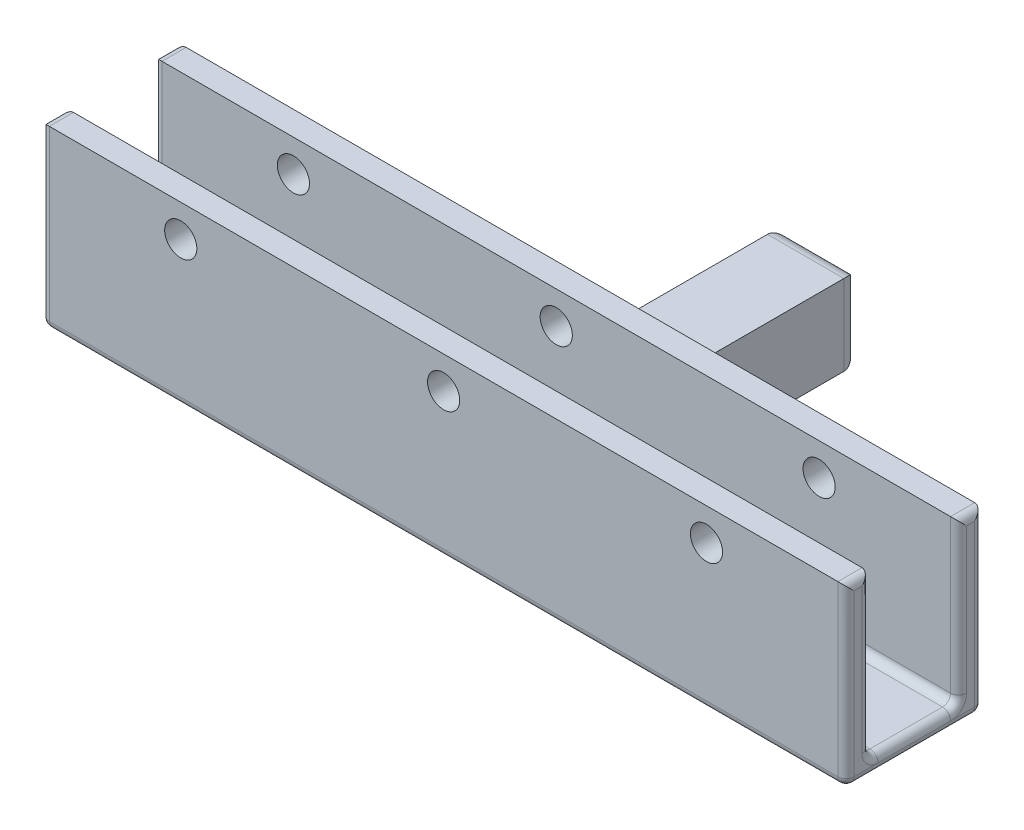
from build123d import *

# Parameters (mm, degrees)
SKETCH2_W                = 100
SKETCH2_H                = 3
SKETCH2_H_2              = 11
BOSS_EXTRUDE2_DEPTH      = 2
SKETCH3_W                = 100
SKETCH3_H                = 3
BOSS_EXTRUDE3_DEPTH      = 20
FILLET2_R                = 1
BOSS_EXTRUDE5_DEPTH      = 30
BOSS_EXTRUDE5_DEPTH_BACK = 1
SKETCH5_W                = 9.5
SKETCH5_H                = 10
FILLET3_R                = 2
FILLET4_R                = 2
SKETCH6_R                = 2
CUT_EXTRUDE1_DEPTH       = 39
SKETCH7_R                = 2
CUT_EXTRUDE2_DEPTH       = 39


# Some blends are built 0.0001 mm under size
with BuildPart() as part:
    # Sketch2 → Boss-Extrude2 (new body)
    with BuildSketch(Plane(origin=(0, 0, 0), x_dir=(1, 0, 0), z_dir=(0, 1, 0))):
        with Locations((-50, 1.5)):
            Rectangle(SKETCH2_W, SKETCH2_H)
        with Locations((-50, -5.5)):
            Rectangle(SKETCH2_W, SKETCH2_H_2)
        with Locations((-50, -12.5)):
            Rectangle(SKETCH2_W, SKETCH2_H)
    extrude(amount=BOSS_EXTRUDE2_DEPTH)

    # Sketch3 → Boss-Extrude3 (add)
    with BuildSketch(Plane(origin=(0, 2, 0), x_dir=(1, 0, 0), z_dir=(0, 1, 0))):
        with Locations((-50, -12.5)):
            Rectangle(SKETCH3_W, SKETCH3_H)
        with Locations((-50, 1.5)):
            Rectangle(SKETCH3_W, SKETCH3_H)
    extrude(amount=BOSS_EXTRUDE3_DEPTH)

    # Fillet2
    fillet2_edges = [part.edges().sort_by_distance(p)[0] for p in [
        (-100, 11, -3),
        (0, 11, -3),
        (0, 11, 14),
        (-100, 11, 14),
        (-100, 2, 5.5),
        (0, 2, 5.5),
        (0, 12, 11),
        (-100, 12, 11),
        (-100, 22, 12.5),
        (0, 22, 12.5),
        (-50, 2, 11),
        (-50, 2, 0),
        (-100, 12, 0),
        (0, 12, 0),
        (-100, 22, -1.5),
        (0, 22, -1.5),
        (-50, 0, -3),
        (0, 0, 5.5),
        (-50, 0, 14),
        (-100, 0, 5.5),
    ]]
    fillet(fillet2_edges, radius=FILLET2_R - 0.0001)  # a hair under: the kernel refuses the full size

    # Sketch5 → Boss-Extrude5 (add, two sides: drawn at the far end of the back side and taken through both)
    with BuildSketch(Plane(origin=(0, 0, -3), x_dir=(-1, 0, 0), z_dir=(0, 0, -1)).offset(-BOSS_EXTRUDE5_DEPTH_BACK)):
        with Locations((50, 5)):
            Rectangle(SKETCH5_W, SKETCH5_H)
    extrude(amount=BOSS_EXTRUDE5_DEPTH + BOSS_EXTRUDE5_DEPTH_BACK)

    # Fillet3
    fillet3_edges = [part.edges().sort_by_distance(p)[0] for p in [
        (-45.25, 5, -33),
        (-50, 0, -33),
        (-54.75, 5, -33),
        (-50, 10, -33),
    ]]
    fillet(fillet3_edges, radius=FILLET3_R)

    # Fillet4
    # the kernel refuses this fillet: 2 mm, written as the material it adds along each edge
    with BuildSketch(Plane(origin=(-54.75, 0.9999, -2.0001), x_dir=(0, 0.0062831439655585564, -0.9999802608561371), z_dir=(0, -0.9999802608561371, -0.0062831439655585564))) as fillet4_piece_1_section:
        with BuildLine():
            CenterArc((-0.9999 - FILLET4_R, -FILLET4_R), FILLET4_R, 0, 90)
            Line((-0.9999, -FILLET4_R), (-0.9999, 0))
            Line((-0.9999, 0), (-0.9999 - FILLET4_R, 0))
        make_face()
    fillet4_piece_1 = revolve(axis=Axis((-54.75, 0.9999, -2.0001), (1, 0, 0)), revolution_arc=359.64, mode=Mode.PRIVATE)
    fillet4_piece_1 = split(fillet4_piece_1, bisect_by=Plane(origin=(-55.461006322, 0, -2.760267515), z_dir=(0, 1, 0)), keep=Keep.TOP, mode=Mode.PRIVATE)
    fillet4_piece_1 = split(fillet4_piece_1, bisect_by=Plane(origin=(-55.461006322, 0.239732481, 0), z_dir=(0, 0, -1)), keep=Keep.TOP, mode=Mode.PRIVATE)
    add(fillet4_piece_1)
    with BuildSketch(Plane(origin=(-45.25, 0.9999, -2.0001), x_dir=(0, 0.0062831439655585564, -0.9999802608561371), z_dir=(0, -0.9999802608561371, -0.0062831439655585564))) as fillet4_piece_2_section:
        with BuildLine():
            CenterArc((-0.9999 - FILLET4_R, FILLET4_R), FILLET4_R, 270, 90)
            Line((-0.9999, FILLET4_R), (-0.9999, 0))
            Line((-0.9999, 0), (-0.9999 - FILLET4_R, 0))
        make_face()
    fillet4_piece_2 = revolve(axis=Axis((-45.25, 0.9999, -2.0001), (1, 0, 0)), revolution_arc=359.64, mode=Mode.PRIVATE)
    fillet4_piece_2 = split(fillet4_piece_2, bisect_by=Plane(origin=(-44.538993678, 0, -2.760267519), z_dir=(0, 1, 0)), keep=Keep.TOP, mode=Mode.PRIVATE)
    fillet4_piece_2 = split(fillet4_piece_2, bisect_by=Plane(origin=(-44.538993678, 0.239732485, 0), z_dir=(0, 0, -1)), keep=Keep.TOP, mode=Mode.PRIVATE)
    add(fillet4_piece_2)
    with BuildSketch(Plane(origin=(-45.25, 10, -3), x_dir=(0, 0, -1), z_dir=(0, -1, 0)), Plane(origin=(-54.75, 0.9999, -3), x_dir=(0, 0, -1), z_dir=(0, 1, 0))) as fillet4_piece_3:
        with BuildLine():
            CenterArc((FILLET4_R, FILLET4_R), FILLET4_R, 180, 90)
            Line((0, FILLET4_R), (0, 0))
            Line((0, 0), (FILLET4_R, 0))
        make_face()
    extrude(amount=9.0001)

    # Sketch6 → Cut-Extrude1 (cut)
    with BuildSketch(Plane(origin=(0, 0, -3), x_dir=(-1, 0, 0), z_dir=(0, 0, -1))):
        with Locations((17.333333335, 18)):
            Circle(SKETCH6_R)
        with Locations((50.000000335, 18)):
            Circle(SKETCH6_R)
        with Locations((82.666667335, 18)):
            Circle(SKETCH6_R)
    extrude(amount=-CUT_EXTRUDE1_DEPTH, mode=Mode.SUBTRACT)

    # Sketch7 → Cut-Extrude2 (cut)
    with BuildSketch(Plane(origin=(0, 10, 0), x_dir=(1, 0, 0), z_dir=(0, 1, 0))):
        with Locations(Location((-50, 11, 0), (0, 0, 270))):
            Circle(SKETCH7_R)
    extrude(amount=-CUT_EXTRUDE2_DEPTH, mode=Mode.SUBTRACT)


solid = part.part
